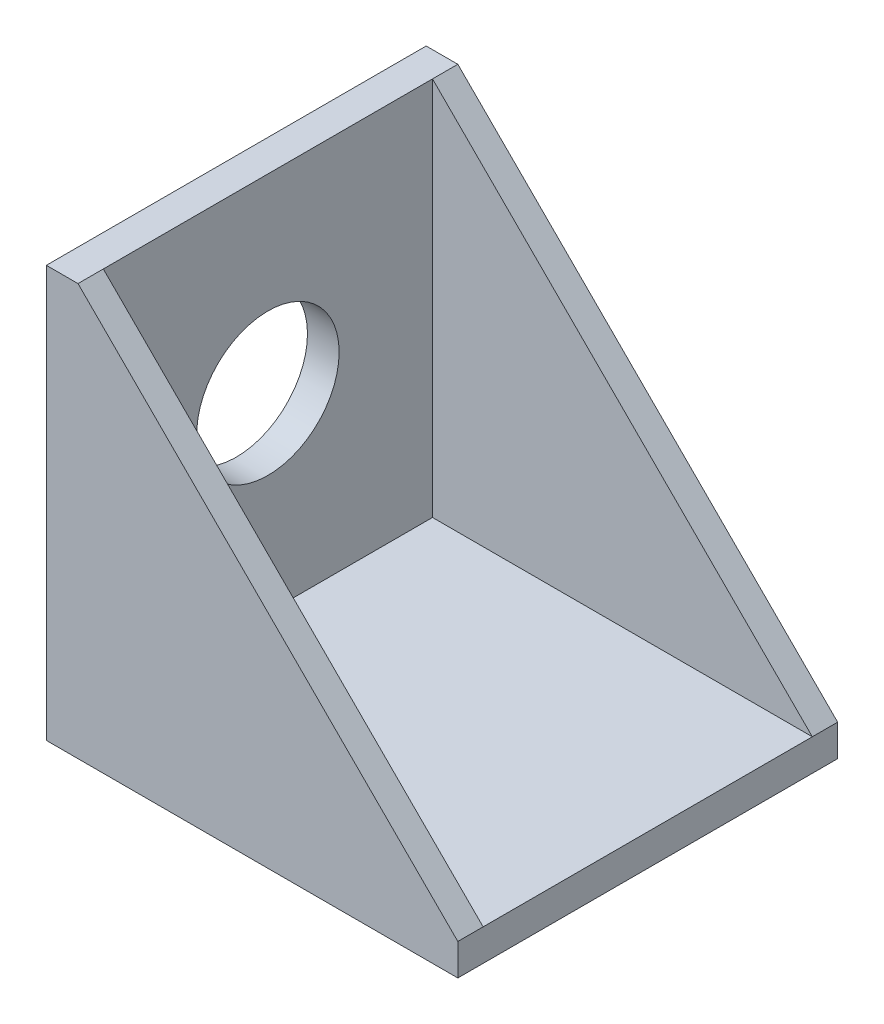
from build123d import *

# Parameters (mm, degrees)
SKETCH1_W           = 76.2
SKETCH1_H           = 6.35
BOSS_EXTRUDE1_DEPTH = 76.2
SKETCH1_3_W         = 76.2
SKETCH1_3_H         = 76.2
SKETCH1_3_R         = 14.2875
BOSS_EXTRUDE2_DEPTH = 6.35
SKETCH3_W           = 6.35
SKETCH3_H           = 76.2
BOSS_EXTRUDE3_DEPTH = 6.35
BOSS_EXTRUDE4_DEPTH = 5.08
BOSS_EXTRUDE5_DEPTH = 5.08


with BuildPart() as part:
    # Sketch1 → Boss-Extrude1 (new body)
    with BuildSketch(Plane(origin=(0, 0, 0), x_dir=(0, 0, -1), z_dir=(1, 0, 0))):
        with Locations((0, -41.275)):
            Rectangle(SKETCH1_W, SKETCH1_H)
    extrude(amount=BOSS_EXTRUDE1_DEPTH)



with BuildPart() as body_2:
    # Sketch1<3> → Boss-Extrude2 (new body)
    with BuildSketch(Plane(origin=(0, 0, 0), x_dir=(0, 0, -1), z_dir=(1, 0, 0))):
        Rectangle(SKETCH1_3_W, SKETCH1_3_H)
        Circle(SKETCH1_3_R, mode=Mode.SUBTRACT)
    extrude(amount=-BOSS_EXTRUDE2_DEPTH)


with BuildPart() as part_1:
    add(part.part)

    add(body_2.part)  # Boss-Extrude3 merges body 2
    # Sketch3 → Boss-Extrude3 (add)
    with BuildSketch(Plane.XZ.offset(38.1)):
        with Locations((-3.175, 0)):
            Rectangle(SKETCH3_W, SKETCH3_H)
    extrude(amount=BOSS_EXTRUDE3_DEPTH)

    # Sketch4 → Boss-Extrude4 (add)
    with BuildSketch(Plane.XY.offset(38.1)):
        Polygon((0, 38.1), (76.2, -38.1), (0, -38.1), align=None)
    extrude(amount=-BOSS_EXTRUDE4_DEPTH)

    # Sketch5 → Boss-Extrude5 (add)
    with BuildSketch(Plane(origin=(0, 0, -38.1), x_dir=(-1, 0, 0), z_dir=(0, 0, -1))):
        Polygon((0, 38.1), (-76.2, -38.1), (0, -38.1), align=None)
    extrude(amount=-BOSS_EXTRUDE5_DEPTH)


solid = part_1.part
